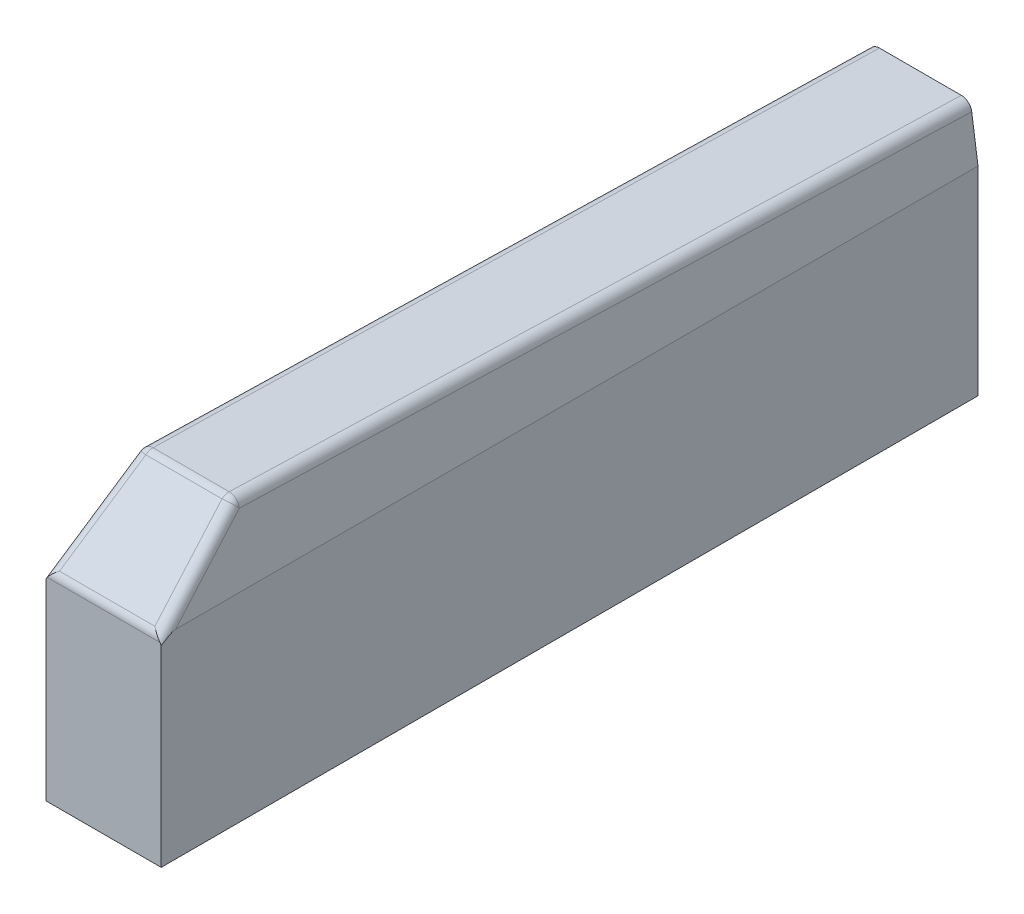
from build123d import *

# Parameters (mm, degrees)
CROQUIS1_W              = 11
CROQUIS1_H              = 78
SALIENTE_EXTRUIR1_DEPTH = 26
CORTAR_EXTRUIR3_DEPTH   = 83.95179323
CORTAR_EXTRUIR6_DEPTH   = 83.95179323
CORTAR_EXTRUIR7_DEPTH   = 83.95179323
REDONDEO4_R             = 1


with BuildPart() as part:
    # Croquis1 → Saliente-Extruir1 (new body)
    with BuildSketch(Plane(origin=(0, 0, 0), x_dir=(1, 0, 0), z_dir=(0, 1, 0))):
        with Locations((5.5, 39)):
            Rectangle(CROQUIS1_W, CROQUIS1_H)
    extrude(amount=SALIENTE_EXTRUIR1_DEPTH)

    # Croquis4 → Cortar-Extruir3 (cut, through all)
    with BuildSketch(Plane.XY):
        Polygon((0, 26), (1, 26), (0, 19), align=None)
        Polygon((10, 26), (11, 26), (11, 19), align=None)
    extrude(amount=-CORTAR_EXTRUIR3_DEPTH, mode=Mode.SUBTRACT)

    # Croquis6 → Cortar-Extruir6 (cut, through all)
    with BuildSketch(Plane.ZY):
        Polygon((0, 19), (0, 26), (-8, 26), align=None)
    extrude(amount=-CORTAR_EXTRUIR6_DEPTH, mode=Mode.SUBTRACT)

    # Croquis8 → Cortar-Extruir7 (cut, through all)
    with BuildSketch(Plane.ZY):
        Polygon((-80, 26), (-6.869978001, 26), (-80, 24), align=None)
    extrude(amount=-CORTAR_EXTRUIR7_DEPTH, mode=Mode.SUBTRACT)

    # Redondeo4
    # the kernel refuses this fillet: 1 mm, written as the material it takes off along each edge
    with BuildSketch(Plane(origin=(1.86153901, 24.959705258, -8.329683982), x_dir=(-0.5677189271234413, -0.022505525063317232, -0.8229147714845281), z_dir=(-0.44431309218949805, 0.8499040291343537, 0.28328257512631844))) as redondeo4_piece_1_section:
        Polygon((-1.655326892, -1.655326892), (1.655326892, -1.655326892), (1.655326892, 1.655326892), (-1.655326892, 1.655326892), align=None)
    redondeo4_piece_1 = extrude(amount=1.655326892, mode=Mode.PRIVATE)
    redondeo4_piece_1 = split(redondeo4_piece_1, bisect_by=Plane(origin=(1.86153901, 24.959705258, -8.329683982), z_dir=(-1, 0, 0)), keep=Keep.TOP, mode=Mode.PRIVATE)
    redondeo4_piece_1 = split(redondeo4_piece_1, bisect_by=Plane(origin=(1.86153901, 24.959705258, -8.329683982), z_dir=(0.09365858115816941, 0.6556100681071857, -0.7492686492653552)), keep=Keep.TOP, mode=Mode.PRIVATE)
    redondeo4_piece_1 = split(redondeo4_piece_1, bisect_by=Plane(origin=(1.86153901, 24.959705258, -8.329683982), z_dir=(0.0039054455429706233, 0.02733811880079436, 0.9996186146503798)), keep=Keep.TOP, mode=Mode.PRIVATE)
    redondeo4_piece_1 = split(redondeo4_piece_1, bisect_by=Plane(origin=(1.86153901, 25.959331496, -8.357022309), z_dir=(0, -0.9996262380814909, 0.027338327290574692)), keep=Keep.TOP, mode=Mode.PRIVATE)
    redondeo4_piece_1 = split(redondeo4_piece_1, bisect_by=Plane(origin=(1.86153901, 25.712281952, -7.671179374), z_dir=(0, -0.7525766947068778, -0.658504607868518)), keep=Keep.TOP, mode=Mode.PRIVATE)
    redondeo4_piece_1 = split(redondeo4_piece_1, bisect_by=Plane(origin=(0.871589516, 25.101126614, -8.329683982), z_dir=(0.9899494936611666, -0.14142135623730953, 0)), keep=Keep.TOP, mode=Mode.PRIVATE)
    redondeo4_piece_1 = redondeo4_piece_1 - Plane(origin=(1.86153901, 24.959705258, -8.329683982), x_dir=(0.44431309218949805, -0.8499040291343537, -0.28328257512631844), z_dir=(-0.5677189271234413, -0.022505525063317232, -0.8229147714845281)) * Sphere(REDONDEO4_R, mode=Mode.PRIVATE)
    add(redondeo4_piece_1, mode=Mode.SUBTRACT)
    with BuildSketch(Plane(origin=(9.13846099, 24.959705258, -8.329683982), x_dir=(-0.5677189271234413, 0.02250552506331723, 0.8229147714845281), z_dir=(0.44431309218949794, 0.8499040291343537, 0.2832825751263184))) as redondeo4_piece_2_section:
        Polygon((-1.655326892, -1.655326892), (1.655326892, -1.655326892), (1.655326892, 1.655326892), (-1.655326892, 1.655326892), align=None)
    redondeo4_piece_2 = extrude(amount=1.655326892, mode=Mode.PRIVATE)
    redondeo4_piece_2 = split(redondeo4_piece_2, bisect_by=Plane(origin=(9.13846099, 24.959705258, -8.329683982), z_dir=(1, 0, 0)), keep=Keep.TOP, mode=Mode.PRIVATE)
    redondeo4_piece_2 = split(redondeo4_piece_2, bisect_by=Plane(origin=(9.13846099, 24.959705258, -8.329683982), z_dir=(-0.09365858115816958, 0.6556100681071857, -0.7492686492653552)), keep=Keep.TOP, mode=Mode.PRIVATE)
    redondeo4_piece_2 = split(redondeo4_piece_2, bisect_by=Plane(origin=(9.13846099, 24.959705258, -8.329683982), z_dir=(-0.0039054455429706303, 0.02733811880079436, 0.9996186146503798)), keep=Keep.TOP, mode=Mode.PRIVATE)
    redondeo4_piece_2 = split(redondeo4_piece_2, bisect_by=Plane(origin=(9.13846099, 25.959331496, -8.357022309), z_dir=(0, -0.9996262380814909, 0.027338327290574692)), keep=Keep.TOP, mode=Mode.PRIVATE)
    redondeo4_piece_2 = split(redondeo4_piece_2, bisect_by=Plane(origin=(9.13846099, 25.712281952, -7.671179374), z_dir=(0, -0.7525766947068778, -0.658504607868518)), keep=Keep.TOP, mode=Mode.PRIVATE)
    redondeo4_piece_2 = split(redondeo4_piece_2, bisect_by=Plane(origin=(10.128410484, 25.101126614, -8.329683982), z_dir=(-0.9899494936611666, -0.14142135623730978, 0)), keep=Keep.TOP, mode=Mode.PRIVATE)
    redondeo4_piece_2 = redondeo4_piece_2 - Plane(origin=(9.13846099, 24.959705258, -8.329683982), x_dir=(-0.44431309218949794, -0.8499040291343537, -0.2832825751263184), z_dir=(-0.5677189271234413, 0.02250552506331723, 0.8229147714845281)) * Sphere(REDONDEO4_R, mode=Mode.PRIVATE)
    add(redondeo4_piece_2, mode=Mode.SUBTRACT)
    with BuildSketch(Plane(origin=(-1.134420566, 19, 0), x_dir=(0, -1, 0), z_dir=(1, 0, 0))) as redondeo4_piece_3:
        with BuildLine():
            CenterArc((REDONDEO4_R * 0.453768226592, REDONDEO4_R), REDONDEO4_R, 221.185925166, 48.814074834)
            Line((-REDONDEO4_R * 0.298808468115, REDONDEO4_R * 0.341495392131), (0, 0))
            Line((0, 0), (REDONDEO4_R * 0.453768226592, 0))
        make_face()
    extrude(amount=13.268841133, mode=Mode.SUBTRACT)
    with BuildSketch(Plane(origin=(0.96681533, 25.767707313, -7.734522643), x_dir=(0.9956043743251828, -0.06167460725908129, 0.07048526543895174), z_dir=(-0.09365858115816941, -0.6556100681071857, 0.7492686492653552)), Plane(origin=(12.052106546, 11.635254179, 8.416852367), x_dir=(-0.9956043743251827, -0.061674607259081395, 0.07048526543895185), z_dir=(-0.09365858115816958, 0.6556100681071857, -0.7492686492653552))) as redondeo4_piece_4:
        with BuildLine():
            CenterArc((REDONDEO4_R * 0.898673913625, -REDONDEO4_R), REDONDEO4_R, 90, 83.890414747)
            Line((-REDONDEO4_R * 0.0956462392286, -REDONDEO4_R * 0.893569583162), (0, 0))
            Line((0, 0), (REDONDEO4_R * 0.898673913625, 0))
        make_face()
    extrude(amount=21.556186859, mode=Mode.SUBTRACT)
    with BuildSketch(Plane(origin=(1.86153901, 25.970032196, -7.965751081), x_dir=(0, -0.6585046078685161, 0.7525766947068797), z_dir=(1, 0, 0))) as redondeo4_piece_5:
        with BuildLine():
            CenterArc((REDONDEO4_R * 0.391417524948, REDONDEO4_R), REDONDEO4_R, 227.247508882, 42.752491118)
            Line((-REDONDEO4_R * 0.287415146966, REDONDEO4_R * 0.265707004295), (0, 0))
            Line((0, 0), (REDONDEO4_R * 0.391417524948, 0))
        make_face()
    extrude(amount=7.27692198, mode=Mode.SUBTRACT)
    with BuildSketch(Plane(origin=(0.994203443, 25.9594241, -8.353636218), x_dir=(-0.14136742020391727, -0.9895719414274202, 0.027615670269893054), z_dir=(-0.0039054455429706233, -0.02733811880079436, -0.9996186146503798)), Plane(origin=(10.286368809, 23.995418339, -80.167528475), x_dir=(0.14136742020391577, -0.9895719414274206, 0.027615670269893058), z_dir=(-0.0039054455429706303, 0.02733811880079436, 0.9996186146503798))) as redondeo4_piece_6:
        with BuildLine():
            CenterArc((REDONDEO4_R * 0.867342181609, -REDONDEO4_R), REDONDEO4_R, 90, 81.872956917)
            Line((-REDONDEO4_R * 0.122614861744, -REDONDEO4_R * 0.85863150168), (0, 0))
            Line((0, 0), (REDONDEO4_R * 0.867342181609, 0))
        make_face()
    extrude(amount=71.841291473, mode=Mode.SUBTRACT)


solid = part.part
